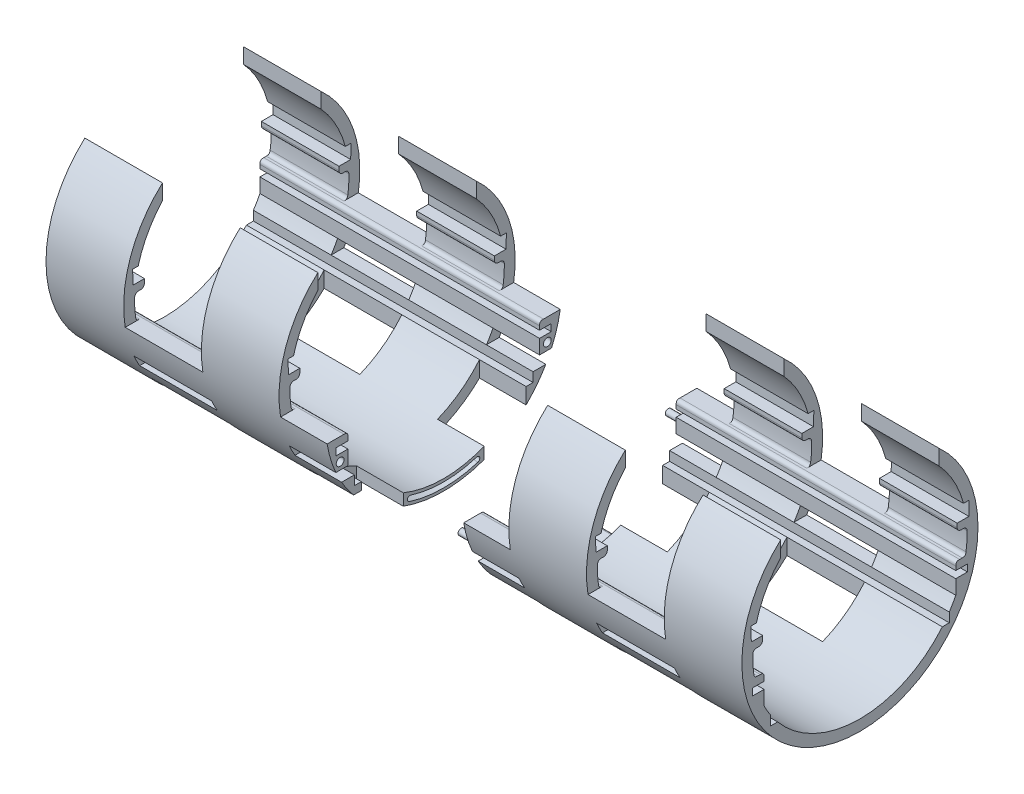
from build123d import *
from build123d.topology import SkipClean

# Parameters (mm, degrees)
SKETCH1_R               = 76
SKETCH1_R_2             = 69
BOSS_EXTRUDE3_DEPTH     = 360
CUT_EXTRUDE1_DEPTH      = 125
CUT_EXTRUDE1_DEPTH_BACK = 135
SKETCH2_W               = 50
SKETCH2_H               = 50
SKETCH2_W_2             = 60
CUT_EXTRUDE3_DEPTH      = 196
CUT_EXTRUDE3_DEPTH_BACK = 244
SKETCH3_W               = 60
SKETCH3_H               = 50
SKETCH3_W_2             = 50
CUT_EXTRUDE4_DEPTH      = 404
BOSS_EXTRUDE5_DEPTH     = 360
CUT_EXTRUDE8_DEPTH      = 360
BOSS_EXTRUDE9_DEPTH     = 360
CUT_EXTRUDE9_DEPTH      = 129
CUT_EXTRUDE9_DEPTH_BACK = 142
SKETCH12_W              = 50
SKETCH12_H              = 16.5
SKETCH12_W_2            = 60
FILLET2_R               = 2.5
CUT_EXTRUDE10_DEPTH     = 360
SKETCH17_R              = 2.5
CUT_EXTRUDE11_DEPTH     = 10
SKETCH20_R              = 2
BOSS_EXTRUDE10_DEPTH    = 10


with BuildPart() as part:
    # Sketch1 → Boss-Extrude3 (new body)
    with BuildSketch(Plane(origin=(0, 0, 0), x_dir=(0, 0, -1), z_dir=(1, 0, 0))):
        with Locations(Location((0, 0, 0), (0, 0, 180))):
            Circle(SKETCH1_R)
        with Locations(Location((0, 0, 0), (0, 0, 180))):
            Circle(SKETCH1_R_2, mode=Mode.SUBTRACT)
    extrude(amount=BOSS_EXTRUDE3_DEPTH)

    # Sketch2 → Cut-Extrude1 (cut, two sides: drawn at the far end of the back side and taken through both)
    with BuildSketch(Plane(origin=(0, 0, 0), x_dir=(1, 0, 0), z_dir=(0, 1, 0)).offset(-CUT_EXTRUDE1_DEPTH_BACK)):
        with Locations((75, 51)):
            Rectangle(SKETCH2_W, SKETCH2_H)
        with Locations((285, 51)):
            Rectangle(SKETCH2_W, SKETCH2_H)
        with Locations((180, 51)):
            Rectangle(SKETCH2_W_2, SKETCH2_H)
    extrude(amount=CUT_EXTRUDE1_DEPTH + CUT_EXTRUDE1_DEPTH_BACK, mode=Mode.SUBTRACT)

    # Sketch3 → Cut-Extrude3 (cut, two sides: drawn at the far end of the back side and taken through both)
    with BuildSketch(Plane(origin=(0, 0, 0), x_dir=(1, 0, 0), z_dir=(0, 1, 0)).offset(-CUT_EXTRUDE3_DEPTH_BACK)):
        with Locations((180, -51)):
            Rectangle(SKETCH3_W, SKETCH3_H)
        with Locations((75, -51)):
            Rectangle(SKETCH3_W_2, SKETCH3_H)
        with Locations((285, -51)):
            Rectangle(SKETCH3_W_2, SKETCH3_H)
    extrude(amount=CUT_EXTRUDE3_DEPTH + CUT_EXTRUDE3_DEPTH_BACK, mode=Mode.SUBTRACT)

    # Sketch4 → Cut-Extrude4 (cut)
    with BuildSketch(Plane.ZY):
        with BuildLine():
            Line((-69.189206, -21.658804), (-65.512565, -21.658804))
            ThreePointArc((-65.512565, -21.658804), (-66.210745, -19.420021), (-66.832443, -17.158804))
            Line((-66.832443, -17.158804), (-69.189206, -17.158804))
            Line((-69.189206, -17.158804), (-69.189206, -21.658804))
        make_face()
        with BuildLine():
            Line((-57.5, -38.141185), (-57.5, -44.158804))
            Line((-57.5, -44.158804), (-53.018865, -44.158804))
            ThreePointArc((-53.018865, -44.158804), (-55.341285, -41.210948), (-57.5, -38.141185))
        make_face()
        with BuildLine():
            ThreePointArc((57.5, -38.141185), (55.341285, -41.210948), (53.018865, -44.158804))
            Line((53.018865, -44.158804), (57.5, -44.158804))
            Line((57.5, -44.158804), (57.5, -38.141185))
        make_face()
        with BuildLine():
            ThreePointArc((66.832443, -17.158804), (66.210745, -19.420021), (65.512565, -21.658804))
            Line((65.512565, -21.658804), (69.189206, -21.658804))
            Line((69.189206, -21.658804), (69.189206, -17.158804))
            Line((69.189206, -17.158804), (66.832443, -17.158804))
        make_face()
    extrude(amount=-CUT_EXTRUDE4_DEPTH, mode=Mode.SUBTRACT)

    # Sketch5 → Boss-Extrude5 (add)
    with BuildSketch(Plane.ZY):
        with BuildLine():
            Line((-65.512565, -21.658804), (-69.189206, -21.658804))
            Line((-69.189206, -21.658804), (-69.189206, -17.158804))
            Line((-69.189206, -17.158804), (-61.689206, -17.158804))
            Line((-61.689206, -17.158804), (-61.689206, -12.158804))
            Line((-61.689206, -12.158804), (-67.920273, -12.158804))
            Line((-67.920273, -12.158804), (-75.021087, -12.158804))
            ThreePointArc((-75.021087, -12.158804), (-72.831657, -21.715195), (-69.430239, -30.910223))
            Line((-69.430239, -30.910223), (-61.689206, -30.910223))
            Line((-61.689206, -30.910223), (-61.689206, -21.658804))
            Line((-61.689206, -21.658804), (-65.512565, -21.658804))
        make_face()
        with BuildLine():
            Line((61.689206, -30.910223), (69.430239, -30.910223))
            ThreePointArc((69.430239, -30.910223), (72.831657, -21.715195), (75.021087, -12.158804))
            Line((75.021087, -12.158804), (67.920273, -12.158804))
            Line((67.920273, -12.158804), (61.689206, -12.158804))
            Line((61.689206, -12.158804), (61.689206, -17.158804))
            Line((61.689206, -17.158804), (69.189206, -17.158804))
            Line((69.189206, -17.158804), (69.189206, -21.658804))
            Line((69.189206, -21.658804), (65.512565, -21.658804))
            Line((65.512565, -21.658804), (61.689206, -21.658804))
            Line((61.689206, -21.658804), (61.689206, -30.910223))
        make_face()
        with BuildLine():
            Line((-57.5, -38.141185), (-65.736215, -38.141185))
            ThreePointArc((-65.736215, -38.141185), (-59.934976, -46.731131), (-53.018865, -54.451814))
            Line((-53.018865, -54.451814), (-53.018865, -44.158804))
            Line((-53.018865, -44.158804), (-57.5, -44.158804))
            Line((-57.5, -44.158804), (-57.5, -38.141185))
        make_face()
        with BuildLine():
            Line((57.5, -38.141185), (57.5, -44.158804))
            Line((57.5, -44.158804), (53.018865, -44.158804))
            Line((53.018865, -44.158804), (53.018865, -49.158804))
            Line((53.018865, -49.158804), (57.960434, -49.158804))
            ThreePointArc((57.960434, -49.158804), (62.093174, -43.822799), (65.736215, -38.141185))
            Line((65.736215, -38.141185), (57.5, -38.141185))
        make_face()
    extrude(amount=-BOSS_EXTRUDE5_DEPTH)

    # Fillet1
    # a fillet whose section is not a circle: 2.5 mm, written as the material it adds along each edge (its section moved 0.00015 mm through the faces so that the kernel can cut it)
    with BuildSketch(Plane(origin=(50, -12.158804, 67.920273), x_dir=(0, 0.9869840744393849, 0.16081802387490868), z_dir=(-1, 0, 0)), Plane(origin=(150, -12.158804, 67.920273), x_dir=(0, 0.9869840744393849, 0.16081802387490868), z_dir=(-1, 0, 0)), Plane(origin=(260, -12.158804, 67.920273), x_dir=(0, 0.9869840744393849, 0.16081802387490868), z_dir=(-1, 0, 0)), Plane(origin=(360, -12.158804, 67.920273), x_dir=(0, 0.9869840744393849, 0.16081802387490868), z_dir=(-1, 0, 0))) as fillet1_piece_1:
        with BuildLine():
            add(Edge.make_bspline([(2.165045, 0), (1.793757, -0.005851), (1.42247, -0.011703), (0.597186, 0.116141), (0.048854, 0.574965), (-0.222526, 1.364769), (-0.282243, 1.73127), (-0.34196, 2.09777)], knots=[0, 0, 0, 0, 0, 0, 0.5, 0.5, 1, 1, 1, 1, 1, 1], degree=5))
            Line((-0.34196, 2.09777), (-0.391309, 2.089729))
            ThreePointArc((-0.391309, 2.089729), (-0.220255, 1.040856), (-0.049349, -0.008041))
            Line((-0.049349, -0.008041), (-0.000781, -0.049994))
            ThreePointArc((-0.000781, -0.049994), (1.082527, -0.058417), (2.165833, -0.049994))
            Line((2.165833, -0.049994), (2.165045, 0))
        make_face()
    extrude(amount=50)
    with BuildSketch(Plane(origin=(360, -12.158804, -67.920273), x_dir=(0, 0.9869840744393849, -0.16081802387490907), z_dir=(-1, 0, 0)), Plane(origin=(260, -12.158804, -67.920273), x_dir=(0, 0.9869840744393849, -0.16081802387490907), z_dir=(-1, 0, 0)), Plane(origin=(150, -12.158804, -67.920273), x_dir=(0, 0.9869840744393849, -0.16081802387490907), z_dir=(-1, 0, 0)), Plane(origin=(50, -12.158804, -67.920273), x_dir=(0, 0.9869840744393849, -0.16081802387490907), z_dir=(-1, 0, 0))) as fillet1_piece_2:
        with BuildLine():
            add(Edge.make_bspline([(2.165045, 0), (1.793757, 0.005851), (1.42247, 0.011703), (0.597186, -0.116141), (0.048854, -0.574965), (-0.222526, -1.364769), (-0.282243, -1.73127), (-0.34196, -2.09777)], knots=[0, 0, 0, 0, 0, 0, 0.5, 0.5, 1, 1, 1, 1, 1, 1], degree=5))
            Line((-0.34196, -2.09777), (-0.391309, -2.089729))
            ThreePointArc((-0.391309, -2.089729), (-0.220255, -1.040856), (-0.049349, 0.008041))
            Line((-0.049349, 0.008041), (-0.000781, 0.049994))
            ThreePointArc((-0.000781, 0.049994), (1.082527, 0.058417), (2.165833, 0.049994))
            Line((2.165833, 0.049994), (2.165045, 0))
        make_face()
    extrude(amount=50)
    # a fillet whose section is not a circle: 2.5 mm, written as the material it takes off along each edge (its section moved 0.00015 mm through the faces so that the kernel can cut it)
    with BuildSketch(Plane(origin=(-6.25, -12.158804, -61.689206), x_dir=(0, 5.9999999891860166e-05, -0.9999999982000001), z_dir=(1, 0, 0))) as fillet1_2_piece_1:
        with BuildLine():
            add(Edge.make_bspline([(2.5, 0), (2.07948, 2.5e-05), (1.658959, 5e-05), (0.732116, -0.179134), (0.179047, -0.732138), (-0.00025, -1.658959), (-0.000275, -2.07948), (-0.0003, -2.5)], knots=[0, 0, 0, 0, 0, 0, 0.5, 0.5, 1, 1, 1, 1, 1, 1], degree=5))
            Line((-0.0003, -2.5), (-0.0503, -2.499997))
            ThreePointArc((-0.0503, -2.499997), (-0.050075, -1.249997), (-0.05, 3e-06))
            Line((-0.05, 3e-06), (3e-06, 0.05))
            ThreePointArc((3e-06, 0.05), (1.250003, 0.049925), (2.500003, 0.05))
            Line((2.500003, 0.05), (2.5, 0))
        make_face()
    extrude(amount=372.5, mode=Mode.SUBTRACT)
    with BuildSketch(Plane(origin=(-6.25, -12.158804, 61.689206), x_dir=(0, 5.9999999891860166e-05, 0.9999999982000001), z_dir=(1, 0, 0))) as fillet1_2_piece_2:
        with BuildLine():
            add(Edge.make_bspline([(2.5, 0), (2.07948, -2.5e-05), (1.658959, -5e-05), (0.732116, 0.179134), (0.179047, 0.732138), (-0.00025, 1.658959), (-0.000275, 2.07948), (-0.0003, 2.5)], knots=[0, 0, 0, 0, 0, 0, 0.5, 0.5, 1, 1, 1, 1, 1, 1], degree=5))
            Line((-0.0003, 2.5), (-0.0503, 2.499997))
            ThreePointArc((-0.0503, 2.499997), (-0.050075, 1.249997), (-0.05, -3e-06))
            Line((-0.05, -3e-06), (3e-06, -0.05))
            ThreePointArc((3e-06, -0.05), (1.250003, -0.049925), (2.500003, -0.05))
            Line((2.500003, -0.05), (2.5, 0))
        make_face()
    extrude(amount=372.5, mode=Mode.SUBTRACT)

    # Sketch6 → Cut-Extrude8 (cut)
    with BuildSketch(Plane.ZY):
        Polygon((69.887341, 8.841196), (70.272421, 17.841196), (-70.327579, 17.841196), (-70.112659, 8.841196), align=None)
    extrude(amount=-CUT_EXTRUDE8_DEPTH, mode=Mode.SUBTRACT)

    # Sketch11 → Boss-Extrude9 (add)
    with BuildSketch(Plane.ZY):
        with BuildLine():
            Line((-70.112659, 8.841196), (-62.612659, 8.841196))
            Line((-62.612659, 8.841196), (-62.612659, 3.841196))
            Line((-62.612659, 3.841196), (-75.902867, 3.841196))
            ThreePointArc((-75.902867, 3.841196), (-75.020086, 12.164978), (-73.227288, 20.341196))
            Line((-73.227288, 20.341196), (-66.65352, 20.341196))
            Line((-66.65352, 20.341196), (-66.65352, 17.841196))
            Line((-66.65352, 17.841196), (-70.327579, 17.841196))
            Line((-70.327579, 17.841196), (-70.112659, 8.841196))
        make_face()
        with BuildLine():
            Line((66.65352, 20.341196), (73.227288, 20.341196))
            ThreePointArc((73.227288, 20.341196), (75.020086, 12.164978), (75.902867, 3.841196))
            Line((75.902867, 3.841196), (62.612659, 3.841196))
            Line((62.612659, 3.841196), (62.612659, 8.841196))
            Line((62.612659, 8.841196), (70.112659, 8.841196))
            Line((70.112659, 8.841196), (70.327579, 17.841196))
            Line((70.327579, 17.841196), (66.65352, 17.841196))
            Line((66.65352, 17.841196), (66.65352, 20.341196))
        make_face()
    extrude(amount=-BOSS_EXTRUDE9_DEPTH)

    # Sketch12 → Cut-Extrude9 (cut, two sides: drawn at the far end of the back side and taken through both)
    with BuildSketch(Plane.XY.offset(-CUT_EXTRUDE9_DEPTH_BACK)):
        with Locations((75, 12.091196)):
            Rectangle(SKETCH12_W, SKETCH12_H)
        with Locations((180, 12.091196)):
            Rectangle(SKETCH12_W_2, SKETCH12_H)
        with Locations((285, 12.091196)):
            Rectangle(SKETCH12_W, SKETCH12_H)
    extrude(amount=CUT_EXTRUDE9_DEPTH + CUT_EXTRUDE9_DEPTH_BACK, mode=Mode.SUBTRACT)

    # Fillet2
    fillet2_edges = [part.edges().sort_by_distance(p)[0] for p in [
        (25, 3.841196, 68.892998),
        (25, 3.841196, 62.612659),
        (125, 3.841196, 68.892998),
        (125, 3.841196, 62.612659),
        (235, 3.841196, 68.892998),
        (235, 3.841196, 62.612659),
        (335, 3.841196, 68.892998),
        (335, 3.841196, 62.612659),
        (25, 3.841196, -62.612659),
        (25, 3.841196, -68.892998),
        (125, 3.841196, -68.892998),
        (125, 3.841196, -62.612659),
        (235, 3.841196, -62.612659),
        (235, 3.841196, -68.892998),
        (335, 3.841196, -62.612659),
        (335, 3.841196, -68.892998),
    ]]
    fillet(fillet2_edges, radius=FILLET2_R)

    # Sketch13 → Cut-Extrude10 (cut)
    with BuildSketch(Plane.ZY):
        with BuildLine():
            ThreePointArc((-51, 46.4758), (-27.876242, 63.118263), (0, 69))
            Line((0, 69), (0, 76))
            ThreePointArc((0, 76), (-27.327802, 70.916791), (-51, 56.347138))
            Line((-51, 56.347138), (-51, 46.4758))
        make_face()
        with BuildLine():
            Line((0, 76), (0, 69))
            ThreePointArc((0, 69), (27.876242, 63.118263), (51, 46.4758))
            Line((51, 46.4758), (51, 56.347138))
            ThreePointArc((51, 56.347138), (27.327802, 70.916791), (0, 76))
        make_face()
    extrude(amount=-CUT_EXTRUDE10_DEPTH, mode=Mode.SUBTRACT)


with BuildPart() as body_2:
    # Split1: the piece on the far side of the plane
    add(part.part)
    split(bisect_by=Plane(origin=(180, 0, 0), x_dir=(0, 0, -1), z_dir=(-1, 0, 0)), keep=Keep.BOTTOM)

    # Sketch20 → Boss-Extrude10 (add)
    with BuildSketch(Plane.ZY.offset(-180)):
        with Locations((66.689206, -26.284514)):
            Circle(SKETCH20_R)
        with Locations(Location((-66.689206, -26.284514, 0), (0, 0, 180))):
            Circle(SKETCH20_R)
        with BuildLine():
            ThreePointArc((-22.305713, -69.952124), (-0.014925, -73.442975), (22.275862, -69.952124))
            ThreePointArc((22.275862, -69.952124), (22.922273, -68.694287), (21.664437, -68.047876))
            ThreePointArc((21.664437, -68.047876), (-0.014925, -71.442975), (-21.694287, -68.047876))
            ThreePointArc((-21.694287, -68.047876), (-22.952124, -68.694287), (-22.305713, -69.952124))
        make_face()
    extrude(amount=BOSS_EXTRUDE10_DEPTH)


with BuildPart() as part_1:
    add(part.part)

    # Split1
    split(bisect_by=Plane(origin=(180, 0, 0), x_dir=(0, 0, -1), z_dir=(-1, 0, 0)), keep=Keep.TOP)


with BuildPart() as part_2:
    # Body-Move/Copy1: read off the stored shape, not the designer's step
    # Body-Move/Copy1: moved
    add(part_1.part.moved(Location((-87.905979, 0, 0))))

    # Sketch17 → Cut-Extrude11 (cut)
    with SkipClean():  # the faces are left unmerged after this step: merging them gives an invalid solid
        with BuildSketch(Plane(origin=(92.094021, 0, 0), x_dir=(0, 0, -1), z_dir=(1, 0, 0))):
            with Locations((66.689206, -26.284514)):
                Circle(SKETCH17_R)
            with Locations(Location((-66.689206, -26.284514, 0), (0, 0, 180))):
                Circle(SKETCH17_R)
            with BuildLine():
                ThreePointArc((-22.244431, -70.729141), (-0.094639, -74.165632), (22.063904, -70.786029))
                ThreePointArc((22.063904, -70.786029), (23.144359, -68.717789), (21.076118, -67.637334))
                ThreePointArc((21.076118, -67.637334), (-0.090402, -70.865634), (-21.248563, -67.582993))
                ThreePointArc((-21.248563, -67.582993), (-23.319571, -68.658133), (-22.244431, -70.729141))
            make_face()
        extrude(amount=-CUT_EXTRUDE11_DEPTH, mode=Mode.SUBTRACT)


solid = Compound([body_2.part, part_2.part])
